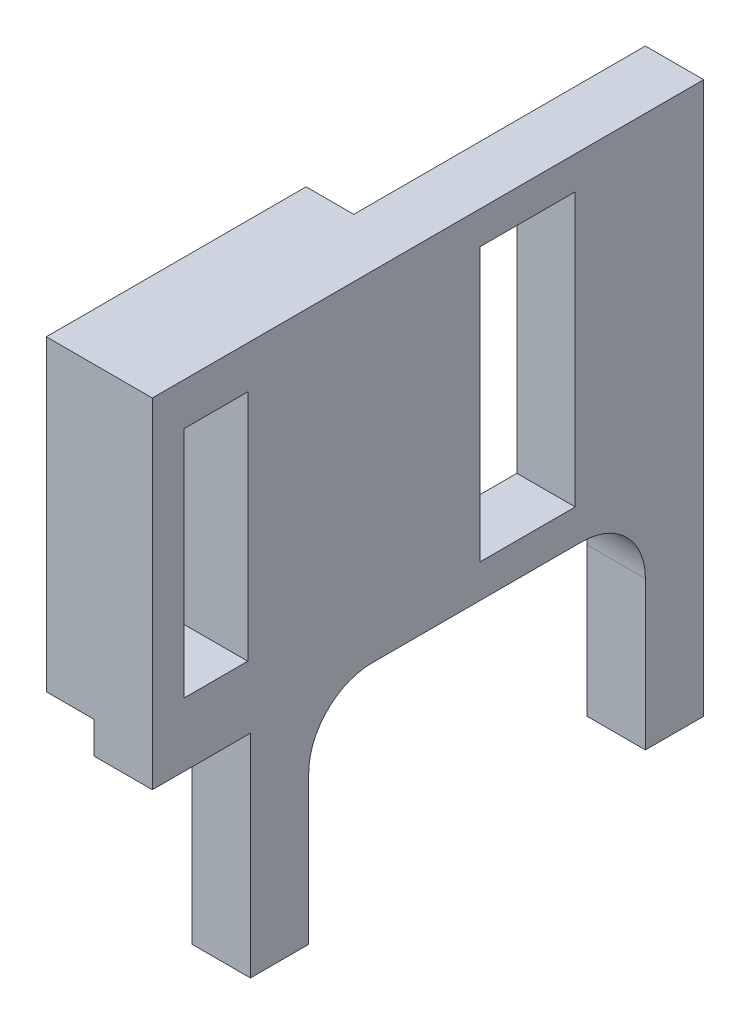
from build123d import *

# Parameters (mm, degrees)
SKETCH1_W           = 52
SKETCH1_H           = 32
BOSS_EXTRUDE1_DEPTH = 10
SKETCH7_W           = 4.5
SKETCH7_H           = 40
CUT_EXTRUDE3_DEPTH  = 43.426406871
SKETCH70_W          = 5.5
SKETCH70_H          = 42.75
BOSS_EXTRUDE4_DEPTH = 20
SKETCH20_W          = 5.5
SKETCH20_H          = 31.75
CUT_EXTRUDE9_DEPTH  = 43.426406871
FILLET1_R           = 6
FILLET2_R           = 6
SKETCH49_W          = 4.5
SKETCH49_H          = 32
BOSS_EXTRUDE3_DEPTH = 12.5
SKETCH50_W          = 4.5
SKETCH50_H          = 24.5
CUT_EXTRUDE19_DEPTH = 3
SKETCH35_W          = 9
SKETCH35_H          = 25.742086546
CUT_EXTRUDE15_DEPTH = 45.746508244
SKETCH67_W          = 5
SKETCH67_H          = 25.742086546
CUT_EXTRUDE22_DEPTH = 3
SKETCH68_W          = 5
SKETCH68_H          = 25.742086546
CUT_EXTRUDE23_DEPTH = 3
SKETCH63_W          = 6
SKETCH63_H          = 22
CUT_EXTRUDE24_DEPTH = 46.519226707
SKETCH76_W          = 10.5
SKETCH76_H          = 22
CUT_EXTRUDE25_DEPTH = 7


with BuildPart() as part:
    # Sketch1 → Boss-Extrude1 (new body)
    with BuildSketch(Plane(origin=(0, 0, 0), x_dir=(0, 0, -1), z_dir=(1, 0, 0))):
        Rectangle(SKETCH1_W, SKETCH1_H)
    extrude(amount=BOSS_EXTRUDE1_DEPTH)

    # Sketch7 → Cut-Extrude3 (cut, through all)
    with BuildSketch(Plane(origin=(0, 16, 0), x_dir=(1, 0, 0), z_dir=(0, 1, 0))):
        with Locations((2.25, 6)):
            Rectangle(SKETCH7_W, SKETCH7_H)
    extrude(amount=-CUT_EXTRUDE3_DEPTH, mode=Mode.SUBTRACT)

    # Sketch70 → Boss-Extrude4 (add)
    with BuildSketch(Plane(origin=(0, -16, 0), x_dir=(-1, 0, 0), z_dir=(0, -1, 0))):
        with Locations((-7.25, 4.625)):
            Rectangle(SKETCH70_W, SKETCH70_H)
    extrude(amount=BOSS_EXTRUDE4_DEPTH)

    # Sketch20 → Cut-Extrude9 (cut, through all)
    with BuildSketch(Plane(origin=(0, -16, 0), x_dir=(-1, 0, 0), z_dir=(0, -1, 0))):
        with Locations((-7.25, 4.625)):
            Rectangle(SKETCH20_W, SKETCH20_H)
    extrude(amount=CUT_EXTRUDE9_DEPTH, mode=Mode.SUBTRACT)

    # Fillet1
    fillet1_edges = [part.edges().sort_by_distance(p)[0] for p in [
        (7.25, -16, -20.5),
    ]]
    fillet(fillet1_edges, radius=FILLET1_R)

    # Fillet2
    fillet2_edges = [part.edges().sort_by_distance(p)[0] for p in [
        (7.25, -16, 11.25),
    ]]
    fillet(fillet2_edges, radius=FILLET2_R)

    # Sketch49 → Boss-Extrude3 (add)
    with BuildSketch(Plane(origin=(0, 0, 14), x_dir=(-1, 0, 0), z_dir=(0, 0, -1))):
        with Locations((-2.25, 0)):
            Rectangle(SKETCH49_W, SKETCH49_H)
    extrude(amount=BOSS_EXTRUDE3_DEPTH)

    # Sketch50 → Cut-Extrude19 (cut)
    with BuildSketch(Plane.XZ.offset(16)):
        with Locations((2.25, 13.75)):
            Rectangle(SKETCH50_W, SKETCH50_H)
    extrude(amount=-CUT_EXTRUDE19_DEPTH, mode=Mode.SUBTRACT)

    # Sketch35 → Cut-Extrude15 (cut, through all)
    with BuildSketch(Plane.ZY.offset(-4.5)):
        with Locations((-9.381446742, 0.030527838)):
            Rectangle(SKETCH35_W, SKETCH35_H)
    extrude(amount=-CUT_EXTRUDE15_DEPTH, mode=Mode.SUBTRACT)

    # Sketch67 → Cut-Extrude22 (cut)
    with BuildSketch(Plane.ZY.offset(-4.5)):
        with Locations((-18.381446742, 0.030527838)):
            Rectangle(SKETCH67_W, SKETCH67_H)
    extrude(amount=-CUT_EXTRUDE22_DEPTH, mode=Mode.SUBTRACT)

    # Sketch68 → Cut-Extrude23 (cut)
    with BuildSketch(Plane.ZY.offset(-4.5)):
        with Locations((-0.381446742, 0.030527838)):
            Rectangle(SKETCH68_W, SKETCH68_H)
    extrude(amount=-CUT_EXTRUDE23_DEPTH, mode=Mode.SUBTRACT)

    # Sketch63 → Cut-Extrude24 (cut, through all)
    with BuildSketch(Plane.ZY):
        with Locations((20, 1)):
            Rectangle(SKETCH63_W, SKETCH63_H)
    extrude(amount=-CUT_EXTRUDE24_DEPTH, mode=Mode.SUBTRACT)

    # Sketch76 → Cut-Extrude25 (cut)
    with BuildSketch(Plane.ZY):
        with Locations((9.75, 1)):
            Rectangle(SKETCH76_W, SKETCH76_H)
    extrude(amount=-CUT_EXTRUDE25_DEPTH, mode=Mode.SUBTRACT)


solid = part.part
